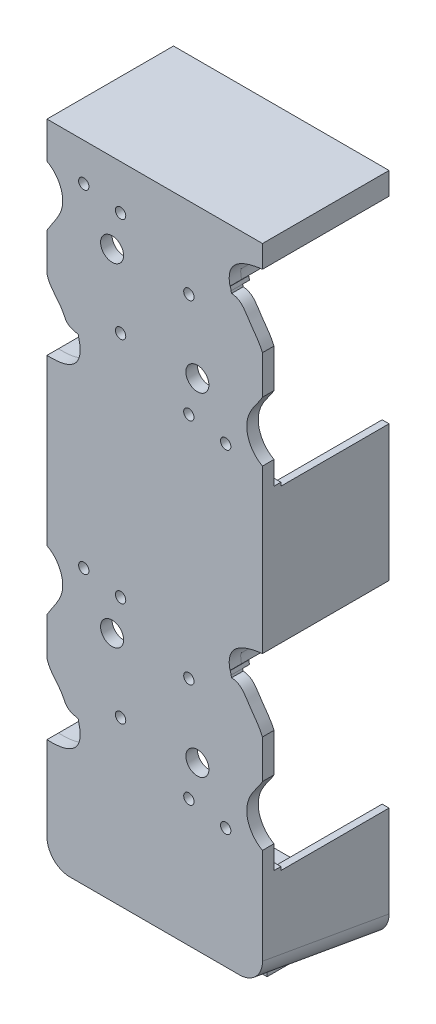
from build123d import *

# Parameters (mm, degrees)
SKETCH1_R            = 2.25
BOSS_EXTRUDE1_DEPTH  = 5
SKETCH7_R            = 2
CUT_EXTRUDE1_DEPTH   = 10
SKETCH8_R            = 5
CUT_EXTRUDE2_DEPTH   = 10
SKETCH10_W           = 93.677769422
SKETCH10_H           = 89.648680449
CUT_EXTRUDE4_DEPTH   = 10
LPATTERN1_COUNT      = 2
LPATTERN1_PITCH      = 144.65
SKETCH13_W           = 93.677769422
SKETCH13_H           = 54.298680449
BOSS_EXTRUDE2_DEPTH  = 5
SKETCH18_W           = 93.677769422
SKETCH18_H           = 5
BOSS_EXTRUDE5_DEPTH  = 5
BOSS_EXTRUDE7_DEPTH  = 8
SKETCH19_W           = 93.677769422
SKETCH19_H           = 5
BOSS_EXTRUDE8_DEPTH  = 47
SKETCH21_W           = 93.677769422
SKETCH21_H           = 5
BOSS_EXTRUDE9_DEPTH  = 3
BOSS_EXTRUDE10_DEPTH = 50
CUT_EXTRUDE5_DEPTH   = 93.677769422
FILLET1_R            = 10


# Read off the part's stored shape, not the designer's step: Boss-Extrude10
with BuildPart() as part:
    # Sketch1 → Boss-Extrude1 (new body)
    with BuildSketch(Plane.XY):
        with BuildLine():
            Line((0, 110), (-46.838884711, 110))
            Line((-46.838884711, 110), (-46.838884711, 100.421650596))
            add(Edge.make_bspline(
                [(-46.838884711, 100.421650596), (-42.226362844, 98.141206473), (-36.711667831, 86.910333368), (-44.527260711, 78.55539065), (-46.838884711, 74.520163403)],
                knots=[0, 0, 0, 0, 0.5133871, 0.998542736, 0.998542736, 0.998542736, 0.998542736], degree=3))
            Line((-46.838884711, 74.520163403), (-46.838884711, 58.109446399))
            add(Edge.make_bspline(
                [(-46.838884711, 58.109446399), (-45.758632516, 53.655222634), (-40.885867203, 50.40646242), (-38.238529072, 43.136574556), (-34.782140744, 42.431604419), (-33.266055192, 42.106985538)],
                knots=[0, 0, 0, 0, 0.587735064, 0.769686025, 1, 1, 1, 1], degree=3))
            add(Edge.make_bspline(
                [(-33.266055192, 42.106985538), (-28.892413212, 26.709459558), (-46.838884711, 27.412777151)],
                knots=[0, 0, 0, 1, 1, 1], degree=2))
            Line((-46.838884711, 27.412777151), (-46.838884711, 7.421650596))
            add(Edge.make_bspline(
                [(-46.838884711, 7.421650596), (-42.226362844, 5.141206473), (-36.711667831, -6.089666632), (-44.527260711, -14.44460935), (-46.838884711, -18.479836597)],
                knots=[0, 0, 0, 0, 0.5133871, 0.998542736, 0.998542736, 0.998542736, 0.998542736], degree=3))
            Line((-46.838884711, -18.479836597), (-46.838884711, -34.890553601))
            add(Edge.make_bspline(
                [(-46.838884711, -34.890553601), (-45.758632516, -39.344777366), (-40.885867203, -42.59353758), (-38.238529072, -49.863425444), (-34.782140744, -50.568395581), (-33.266055192, -50.893014462)],
                knots=[0, 0, 0, 0, 0.587735064, 0.769686025, 1, 1, 1, 1], degree=3))
            add(Edge.make_bspline(
                [(-33.266055192, -50.893014462), (-28.892413212, -66.290540442), (-46.838884711, -65.587222849)],
                knots=[0, 0, 0, 1, 1, 1], degree=2))
            Line((-46.838884711, -65.587222849), (-46.838884711, -70))
            Line((-46.838884711, -70), (0, -70))
            Line((0, -70), (46.838884711, -70))
            Line((46.838884711, -70), (46.838884711, -60.421650596))
            add(Edge.make_bspline(
                [(46.838884711, -60.421650596), (42.982832164, -58.395834606), (38.906182163, -51.871311027), (41.138601483, -41.632996987), (45.188996373, -37.461060264), (46.838884711, -34.520947075)],
                knots=[0, 0, 0, 0, 0.434931401, 0.661677592, 0.998582109, 0.998582109, 0.998582109, 0.998582109], degree=3))
            Line((46.838884711, -34.520947075), (46.838884711, -17.744628899))
            add(Edge.make_bspline(
                [(46.838884711, -17.744628899), (45.396033977, -14.277729688), (40.758990778, -9.004665614), (37.573327769, -2.447994476), (33.443642317, -2.141285146)],
                knots=[0, 0, 0, 0, 0.525454982, 1, 1, 1, 1], degree=3))
            add(Edge.make_bspline(
                [(33.443642317, -2.141285146), (28.416523532, 11.559488336), (46.838884711, 13.634393344)],
                knots=[0, 0, 0, 1, 1, 1], degree=2))
            Line((46.838884711, 13.634393344), (46.838884711, 32.578349404))
            add(Edge.make_bspline(
                [(46.838884711, 32.578349404), (42.982832164, 34.604165394), (38.906182163, 41.128688973), (41.138601483, 51.367003013), (45.188996373, 55.538939736), (46.838884711, 58.479052925)],
                knots=[0, 0, 0, 0, 0.434931401, 0.661677592, 0.998582109, 0.998582109, 0.998582109, 0.998582109], degree=3))
            Line((46.838884711, 58.479052925), (46.838884711, 75.255371101))
            add(Edge.make_bspline(
                [(46.838884711, 75.255371101), (45.396033977, 78.722270312), (40.758990778, 83.995334386), (37.573327769, 90.552005524), (33.443642317, 90.858714854)],
                knots=[0, 0, 0, 0, 0.525454982, 1, 1, 1, 1], degree=3))
            Line((33.443642317, 90.858714854), (0, 110))
        make_face()
        with Locations((-14.838884711, -41.25)):
            Circle(SKETCH1_R, mode=Mode.SUBTRACT)
        with Locations((-30.838884711, 7)):
            Circle(SKETCH1_R, mode=Mode.SUBTRACT)
        with Locations((-14.838884711, 4)):
            Circle(SKETCH1_R, mode=Mode.SUBTRACT)
        with Locations((14.838884711, -57)):
            Circle(SKETCH1_R, mode=Mode.SUBTRACT)
        with Locations((30.838884711, -60)):
            Circle(SKETCH1_R, mode=Mode.SUBTRACT)
        with Locations((14.838884711, -11.75)):
            Circle(SKETCH1_R, mode=Mode.SUBTRACT)
        with Locations((-14.838884711, 51.75)):
            Circle(SKETCH1_R, mode=Mode.SUBTRACT)
        with Locations((-30.838884711, 100)):
            Circle(SKETCH1_R, mode=Mode.SUBTRACT)
        with Locations((-14.838884711, 97)):
            Circle(SKETCH1_R, mode=Mode.SUBTRACT)
        with Locations((14.838884711, 36)):
            Circle(SKETCH1_R, mode=Mode.SUBTRACT)
        with Locations((30.838884711, 33)):
            Circle(SKETCH1_R, mode=Mode.SUBTRACT)
        with Locations((14.838884711, 81.25)):
            Circle(SKETCH1_R, mode=Mode.SUBTRACT)
    extrude(amount=BOSS_EXTRUDE1_DEPTH)

    # Sketch7 → Cut-Extrude1 (cut)
    with BuildSketch(Plane.XY.offset(5)):
        with Locations((-41.838884711, 23.5)):
            Circle(SKETCH7_R)
        with Locations((-41.838884711, 67)):
            Circle(SKETCH7_R)
        with Locations((40.861115289, 67)):
            Circle(SKETCH7_R)
        with Locations((40.861115289, 23.5)):
            Circle(SKETCH7_R)
    extrude(amount=-CUT_EXTRUDE1_DEPTH, mode=Mode.SUBTRACT)

    # Sketch8 → Cut-Extrude2 (cut)
    with BuildSketch(Plane(origin=(0, 0, 0), x_dir=(-1, 0, 0), z_dir=(0, 0, -1))):
        with Locations((-18.538884711, -41.6)):
            Circle(SKETCH8_R)
        with Locations((-18.538884711, 51.4)):
            Circle(SKETCH8_R)
        with Locations((18.538884711, 81.6)):
            Circle(SKETCH8_R)
        with Locations((18.538884711, -11.4)):
            Circle(SKETCH8_R)
    extrude(amount=-CUT_EXTRUDE2_DEPTH, mode=Mode.SUBTRACT)

    # Sketch10 → Cut-Extrude4 (cut)
    with BuildSketch(Plane.XY.offset(5)):
        with Locations((0, 65.175659775)):
            Rectangle(SKETCH10_W, SKETCH10_H)
    extrude(amount=-CUT_EXTRUDE4_DEPTH, mode=Mode.SUBTRACT)


with BuildPart() as lpattern1_1:
    # LPattern1: pattern copy
    add(part.part.moved(Location(Vector(0, -1, 0) * (1 * LPATTERN1_PITCH))))


with BuildPart() as part_1:
    add(part.part)

    add(lpattern1_1.part)  # Boss-Extrude2 merges LPattern1_1
    # Sketch13 → Boss-Extrude2 (add)
    with BuildSketch(Plane.XY.offset(5)):
        with Locations((0, -97.149340225)):
            Rectangle(SKETCH13_W, SKETCH13_H)
    extrude(amount=-BOSS_EXTRUDE2_DEPTH)

    # Sketch18 → Boss-Extrude5 (add)
    with BuildSketch(Plane.XY.offset(5)):
        with Locations((0, -217.15)):
            Rectangle(SKETCH18_W, SKETCH18_H)
    extrude(amount=-BOSS_EXTRUDE5_DEPTH)

    # Sketch17 → Boss-Extrude7 (add)
    with BuildSketch(Plane.XY.offset(5)):
        Polygon((33.137486483, -1.25), (4.338884711, -1.25), (4.338884711, -70.5), (46.838884711, -70.5), (46.838884711, -72), (2.838884711, -72), (2.838884711, 0.25), (32.841973097, 0.25), (33.225056852, -1.25), align=None)
        Polygon((-33.036788629, -51.75), (-4.338884711, -51.75), (-4.338884711, 17.5), (-46.838884711, 17.5), (-46.838884711, 19), (-2.838884711, 19), (-2.838884711, -53.25), (-32.814550412, -53.25), (-33.107034097, -51.75), align=None)
        Polygon((-33.036788629, -196.4), (-4.338884711, -196.4), (-4.338884711, -127.15), (-46.838884711, -127.15), (-46.838884711, -125.65), (-2.838884711, -125.65), (-2.838884711, -197.9), (-32.814550412, -197.9), (-33.107034097, -196.4), align=None)
        Polygon((33.137486483, -145.9), (4.338884711, -145.9), (4.338884711, -215.15), (46.838884711, -215.15), (46.838884711, -216.65), (2.838884711, -216.65), (2.838884711, -144.4), (32.841973097, -144.4), (33.225056852, -145.9), align=None)
    extrude(amount=-BOSS_EXTRUDE7_DEPTH)

    # Sketch19 → Boss-Extrude8 (add)
    with BuildSketch(Plane.XZ.offset(219.65)):
        with Locations((0, 2.5)):
            Rectangle(SKETCH19_W, SKETCH19_H)
    extrude(amount=BOSS_EXTRUDE8_DEPTH)

    # Sketch21 → Boss-Extrude9 (add)
    with BuildSketch(Plane(origin=(0, 20.351319551, 0), x_dir=(1, 0, 0), z_dir=(0, 1, 0))):
        with Locations((0, -2.5)):
            Rectangle(SKETCH21_W, SKETCH21_H)
    extrude(amount=BOSS_EXTRUDE9_DEPTH)

    # Boss-Extrude10 outline → Boss-Extrude10 (add)
    with BuildSketch(Plane(origin=(0, 0, 0), x_dir=(-1, 0, 0), z_dir=(0, 0, -1))):
        with BuildLine():
            add(Edge.make_bspline(
                [(-32.724261898, 0.25), (-32.245095706, 2.312784936), (-32.402626668, 4.067426464)],
                knots=[0, 0, 0, 0.181136716, 0.181136716, 0.181136716], degree=2))
            Line((-32.724261898, 0.25), (-29.65751977, 0.25))
            add(Edge.make_bspline(
                [(-29.65751977, 0.25), (-29.601842647, 0.538366952), (-29.466363581, 1.344697446), (-29.301208708, 3.141766485), (-29.47061633, 5.619429231), (-30.412970229, 8.408598154), (-32.080129332, 10.83738709), (-34.332026266, 12.794823629), (-37.046086715, 14.308755459), (-39.670197714, 15.260630902), (-41.969837518, 15.859321379), (-43.221486034, 16.113254715), (-43.838884711, 16.22336356)],
                knots=[0.025422655, 0.025422655, 0.025422655, 0.025422655, 0.057672577, 0.115345154, 0.230690308, 0.346035462, 0.461380617, 0.576725771, 0.692070925, 0.807416079, 0.865088656, 0.922761233, 0.922761233, 0.922761233, 0.922761233], degree=3))
            Line((-43.838884711, 16.22336356), (-43.838884711, 20.351319551))
            Line((-43.838884711, 20.351319551), (43.838884711, 20.351319551))
            Line((43.838884711, 20.351319551), (43.838884711, 19))
            Line((43.838884711, 19), (46.838884711, 19))
            Line((46.838884711, 19), (46.838884711, 23.351319551))
            Line((46.838884711, 23.351319551), (-46.838884711, 23.351319551))
            Line((-46.838884711, 23.351319551), (-46.838884711, 13.634393344))
            add(Edge.make_bspline(
                [(-32.402626668, 4.067426464), (-33.094751911, 12.086395793), (-46.838884711, 13.634393344)],
                knots=[0.25394293, 0.25394293, 0.25394293, 1, 1, 1], degree=2))
        make_face()
        with BuildLine():
            add(Edge.make_bspline(
                [(32.709776931, -53.25), (31.734780647, -58.560461643), (33.920713563, -61.590754477)],
                knots=[0.079873384, 0.079873384, 0.079873384, 0.456195017, 0.456195017, 0.456195017], degree=2))
            Line((32.709776931, -53.25), (29.686037828, -53.25))
            add(Edge.make_bspline(
                [(29.686037828, -53.25), (29.634192678, -53.687923423), (29.539481128, -54.70355896), (29.483724619, -56.756741513), (29.74252868, -59.346280005), (30.679575089, -62.194308917), (32.320972507, -64.672442104), (34.599137468, -66.583401056), (37.324789378, -67.85754095), (39.883504821, -68.448925754), (42.079308292, -68.681499333), (43.258792902, -68.722377725), (43.838884711, -68.724786237)],
                knots=[0.01311385, 0.01311385, 0.01311385, 0.01311385, 0.056313431, 0.112626863, 0.225253726, 0.337880589, 0.450507452, 0.563134315, 0.675761178, 0.788388041, 0.844701472, 0.901014903, 0.901014903, 0.901014903, 0.901014903], degree=3))
            Line((43.838884711, -68.724786237), (43.838884713, -125.65))
            Line((43.838884713, -125.65), (46.838884711, -125.65))
            Line((46.838884711, -125.65), (46.838884711, -65.587222848))
            add(Edge.make_bspline(
                [(33.920713563, -61.590754477), (36.999202525, -66.479878046), (46.838884711, -65.587222848)],
                knots=[0.383965009, 0.383965009, 0.383965009, 1, 1, 1], degree=2))
        make_face()
        with BuildLine():
            add(Edge.make_bspline(
                [(-32.724261899, -144.4), (-32.245095735, -142.337215187), (-32.40262665, -140.582573745)],
                knots=[0, 0, 0, 0.181136705, 0.181136705, 0.181136705], degree=2))
            Line((-32.724261899, -144.4), (-29.65751977, -144.4))
            add(Edge.make_bspline(
                [(-29.65751977, -144.4), (-29.601842648, -144.111633048), (-29.466363582, -143.305302554), (-29.301208708, -141.508233515), (-29.470616331, -139.03057077), (-30.412970229, -136.241401847), (-32.080129332, -133.81261291), (-34.332026266, -131.855176372), (-37.046086715, -130.341244542), (-39.670197714, -129.389369098), (-41.969837518, -128.790678621), (-43.221486034, -128.536745285), (-43.838884711, -128.42663644)],
                knots=[0.025422655, 0.025422655, 0.025422655, 0.025422655, 0.057672577, 0.115345154, 0.230690308, 0.346035462, 0.461380617, 0.576725771, 0.692070925, 0.807416079, 0.865088656, 0.922761233, 0.922761233, 0.922761233, 0.922761233], degree=3))
            Line((-43.838884711, -128.42663644), (-43.838884711, -72))
            Line((-43.838884711, -72), (-46.838884711, -72))
            Line((-46.838884711, -72), (-46.838884711, -131.015606656))
            add(Edge.make_bspline(
                [(-32.40262665, -140.582573745), (-33.094751732, -132.563604227), (-46.838884711, -131.015606656)],
                knots=[0.25394292, 0.25394292, 0.25394292, 1, 1, 1], degree=2))
        make_face()
        with BuildLine():
            add(Edge.make_bspline(
                [(32.709776931, -197.9), (31.734780645, -203.210461655), (33.920713573, -206.240754491)],
                knots=[0.079873384, 0.079873384, 0.079873384, 0.456195018, 0.456195018, 0.456195018], degree=2))
            Line((32.709776931, -197.9), (29.68603783, -197.9))
            add(Edge.make_bspline(
                [(29.68603783, -197.9), (29.634192679, -198.337923423), (29.53948113, -199.35355896), (29.483724621, -201.406741512), (29.742528681, -203.996280004), (30.67957509, -206.844308916), (32.320972507, -209.322442104), (34.599137469, -211.233401056), (37.324789378, -212.50754095), (39.883504821, -213.098925753), (42.079308292, -213.331499332), (43.258792902, -213.372377725), (43.838884711, -213.374786236)],
                knots=[0.01311385, 0.01311385, 0.01311385, 0.01311385, 0.056313431, 0.112626863, 0.225253726, 0.337880589, 0.450507452, 0.563134315, 0.675761178, 0.788388041, 0.844701472, 0.901014903, 0.901014903, 0.901014903, 0.901014903], degree=3))
            Line((43.838884711, -213.374786236), (43.838884711, -256.65))
            Line((43.838884711, -256.65), (-43.838884711, -256.65))
            Line((-43.838884711, -256.65), (-43.838884711, -216.65))
            Line((-43.838884711, -216.65), (-46.838884711, -216.65))
            Line((-46.838884711, -216.65), (-46.838884711, -266.65))
            Line((-46.838884711, -266.65), (46.838884711, -266.65))
            Line((46.838884711, -266.65), (46.838884711, -210.237222849))
            add(Edge.make_bspline(
                [(33.920713573, -206.240754491), (36.999202539, -211.129878044), (46.838884711, -210.237222849)],
                knots=[0.38396501, 0.38396501, 0.38396501, 1, 1, 1], degree=2))
        make_face()
    extrude(amount=BOSS_EXTRUDE10_DEPTH)

    # Sketch24 → Cut-Extrude5 (cut)
    with BuildSketch(Plane.ZY.offset(46.838884711)):
        Polygon((-50, -266.65), (5, -256.952016061), (5, -266.65), align=None)
    extrude(amount=-CUT_EXTRUDE5_DEPTH, mode=Mode.SUBTRACT)

    # Fillet1
    fillet1_edges = [part_1.edges().sort_by_distance(p)[0] for p in [
        (-46.838884711, -261.801008031, -22.5),
        (46.838884711, -261.801008031, -22.5),
    ]]
    fillet(fillet1_edges, radius=FILLET1_R)


solid = part_1.part
